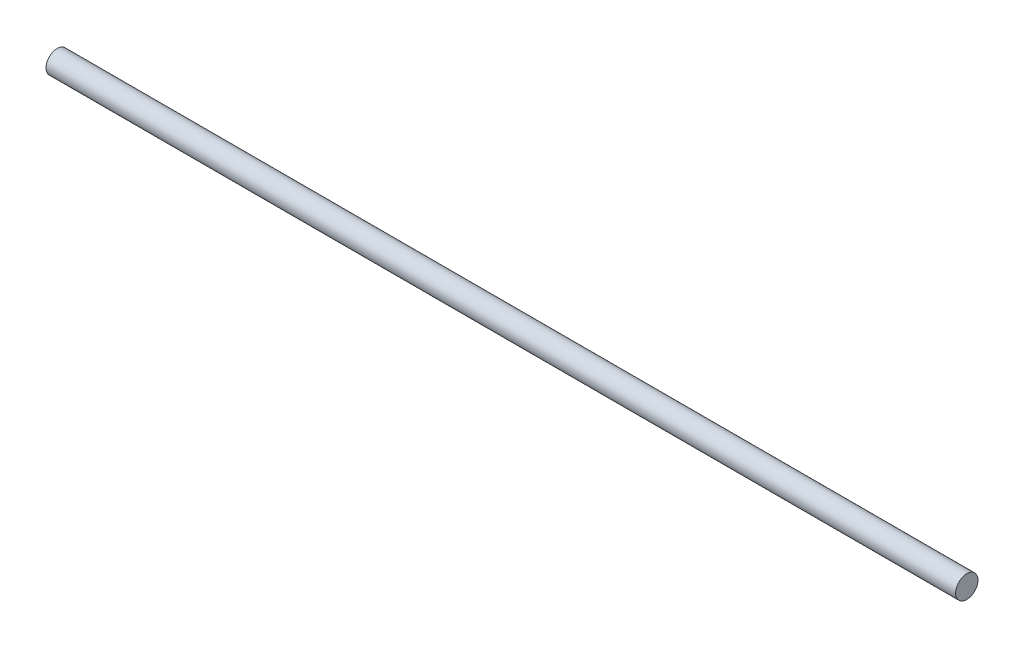
from build123d import *

# Parameters (mm, degrees)
SKETCH1_R           = 4
BOSS_EXTRUDE1_DEPTH = 325


with BuildPart() as part:
    # Sketch1 → Boss-Extrude1 (new body)
    with BuildSketch(Plane(origin=(0, 0, 0), x_dir=(0, 0, -1), z_dir=(1, 0, 0))):
        Circle(SKETCH1_R)
    extrude(amount=BOSS_EXTRUDE1_DEPTH)


solid = part.part
